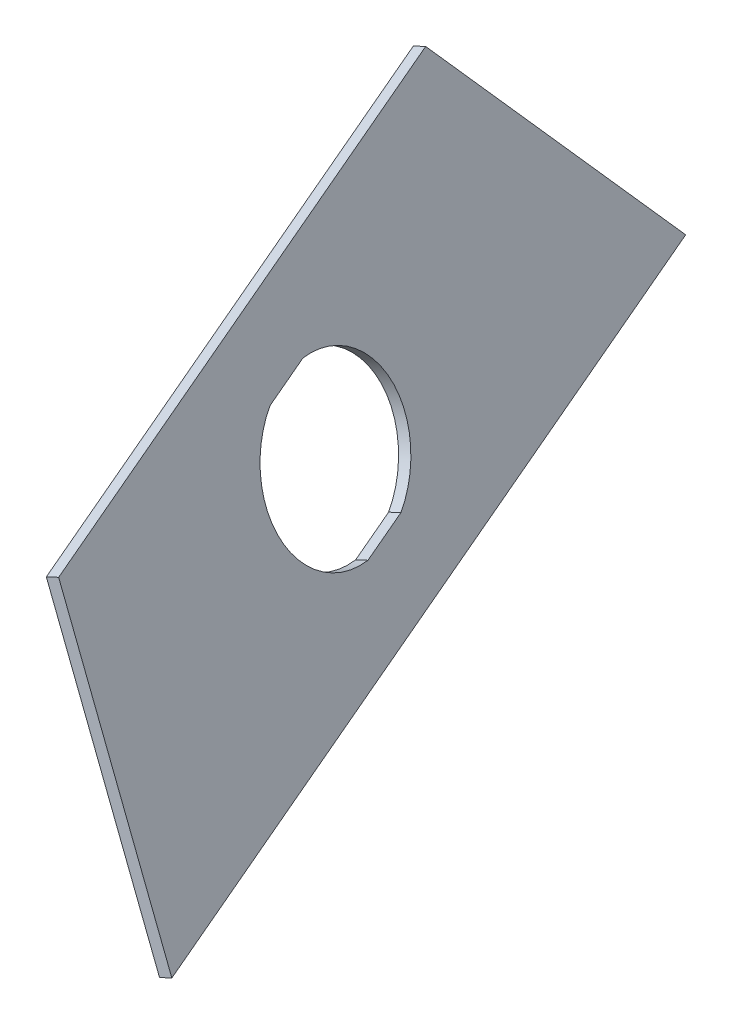
from build123d import *

# Parameters (mm, degrees)
BOSS_EXTRUDE1_DEPTH = 1.5875


with BuildPart() as part:
    # Sketch40 → Boss-Extrude1 (new body)
    with BuildSketch(Plane(origin=(-456.955039877, 178.120588246, -67.48659487), x_dir=(-0.12701055438256242, 0.049508578931906196, 0.9906650390962515), z_dir=(-0.9230204054682252, 0.3597923717602288, -0.13631867191409483))):
        Polygon((-143.227084656, 906.623268698), (-170.661347691, 874.056453533), (-74.641427067, 839.002915601), (-74.641427067, 881.585027318), align=None)
        with BuildLine():
            Line((-115.271977523, 886.304578524), (-109.11217167, 884.055847358))
            ThreePointArc((-109.11217167, 884.055847358), (-105.459844174, 871.54470512), (-116.313665717, 864.329254051))
            Line((-116.313665717, 864.329254051), (-122.47347157, 866.577985217))
            ThreePointArc((-122.47347157, 866.577985217), (-126.125799067, 879.089127455), (-115.271977523, 886.304578524))
        make_face(mode=Mode.SUBTRACT)
    extrude(amount=BOSS_EXTRUDE1_DEPTH)


with BuildPart() as body_2:
    # Mirror2: mirrored copy
    add(part.part.mirror(Plane(origin=(0, 0, 0), x_dir=(0, 0, 1), z_dir=(1, 0, 0))))


solid = body_2.part
